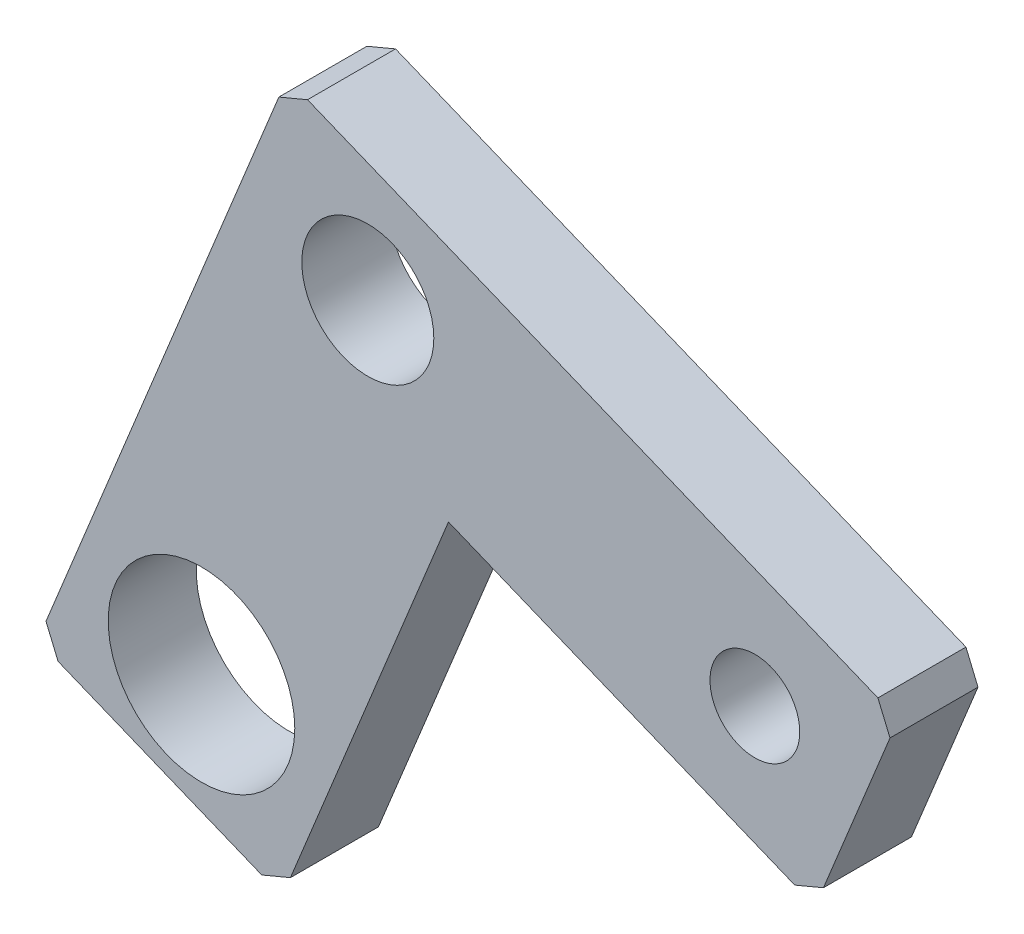
from build123d import *

# Parameters (mm, degrees)
SKETCH_1_R      = 5.1
SKETCH_1_R_2    = 7.5
SKETCH_1_R_3    = 10.6
EXTRUDE_1_DEPTH = 10
CHAMFER_1_SIZE  = 2.5


with BuildPart() as part:
    # 草圖1 → 填料-伸長1 (new body)
    with BuildSketch(Plane.XY):
        Polygon((-42.684704159, 14.950876454), (26.753169389, -13.39311263), (17.305173028, -36.539070479), (-24.357551101, -19.532677029), (-43.253543823, -65.824592728), (-71.028693242, -54.486997094), align=None)
        with Locations((10.456192284, -20.242093374)):
            Circle(SKETCH_1_R, mode=Mode.SUBTRACT)
        with Locations((-33.52112763, -2.290900288)):
            Circle(SKETCH_1_R_2, mode=Mode.SUBTRACT)
        with Locations((-52.417120352, -48.582815986)):
            Circle(SKETCH_1_R_3, mode=Mode.SUBTRACT)
    extrude(amount=-EXTRUDE_1_DEPTH)

    # 導角1
    chamfer_1_edges = [part.edges().sort_by_distance(p)[0] for p in [
        (-43.253543823, -65.824592728, -5),
        (17.305173028, -36.539070479, -5),
        (26.753169389, -13.39311263, -5),
        (-71.028693242, -54.486997094, -5),
        (-42.684704159, 14.950876454, -5),
    ]]
    chamfer(chamfer_1_edges, length=CHAMFER_1_SIZE)


solid = part.part
